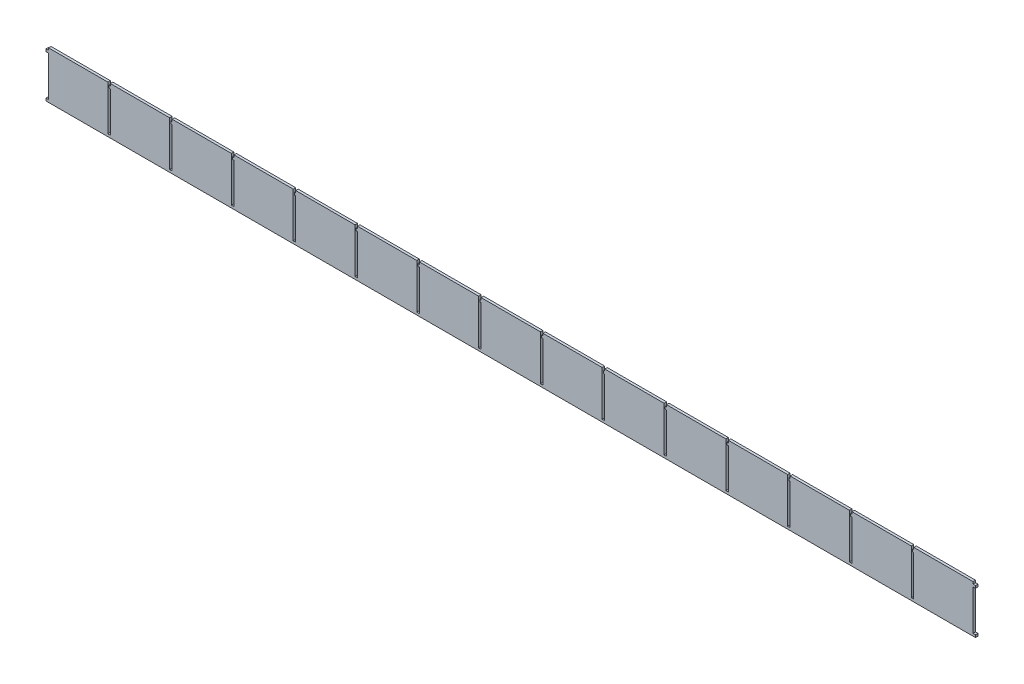
from build123d import *

# Parameters (mm, degrees)
BOSS_EXTRUDE1_DEPTH = 4


with BuildPart() as part:
    # Sketch2 → Boss-Extrude1 (new body)
    with BuildSketch(Plane.XY):
        Polygon((-666.946628487, 43.568155794), (-762.946628487, 43.568155794), (-762.946628487, 40.044337109), (-766.946628487, 40.044337109), (-766.946628487, 36.144337109), (-762.946628487, 36.144337109), (-762.946628487, -28.948182921), (-766.946628487, -28.948182921), (-766.946628487, -32.948182921), (737.053371513, -32.948182921), (737.053371513, -28.948182921), (733.053371513, -28.948182921), (733.053371513, 36.144337109), (734.953371513, 36.144337109), (737.053371513, 36.144337109), (737.053371513, 40.044337109), (733.053371513, 40.044337109), (733.053371513, 43.568155794), (637.053371513, 43.568155794), (637.053371513, 40.044337109), (634.953371513, 40.044337109), (634.953371513, 36.144337109), (637.053371513, 36.144337109), (637.053371513, -28.948182921), (633.053371513, -28.948182921), (633.053371513, 43.568155794), (537.053371513, 43.568155794), (537.053371513, 40.044337109), (534.953371513, 40.044337109), (534.953371513, 36.144337109), (537.053371513, 36.144337109), (537.053371513, -28.948182921), (533.053371513, -28.948182921), (533.053371513, 43.568155794), (437.053371513, 43.568155794), (437.053371513, 40.044337109), (434.953371513, 40.044337109), (434.953371513, 36.144337109), (437.053371513, 36.144337109), (437.053371513, -28.948182921), (433.053371513, -28.948182921), (433.053371513, 43.568155794), (337.053371513, 43.568155794), (337.053371513, 40.044337109), (334.953371513, 40.044337109), (334.953371513, 36.144337109), (337.053371513, 36.144337109), (337.053371513, -28.948182921), (333.053371513, -28.948182921), (333.053371513, 43.568155794), (237.053371513, 43.568155794), (237.053371513, 40.044337109), (234.953371513, 40.044337109), (234.953371513, 36.144337109), (237.053371513, 36.144337109), (237.053371513, -28.948182921), (233.053371513, -28.948182921), (233.053371513, 43.568155794), (137.053371513, 43.568155794), (137.053371513, 40.044337109), (134.953371513, 40.044337109), (134.953371513, 36.144337109), (137.053371513, 36.144337109), (137.053371513, -28.948182921), (133.053371513, -28.948182921), (133.053371513, 43.568155794), (37.053371513, 43.568155794), (37.053371513, 40.044337109), (34.953371513, 40.044337109), (34.953371513, 36.144337109), (37.053371513, 36.144337109), (37.053371513, -28.948182921), (33.053371513, -28.948182921), (33.053371513, 43.568155794), (-62.946628487, 43.568155794), (-62.946628487, 40.044337109), (-65.046628487, 40.044337109), (-65.046628487, 36.144337109), (-62.946628487, 36.144337109), (-62.946628487, -28.948182921), (-66.946628487, -28.948182921), (-66.946628487, 43.568155794), (-162.946628487, 43.568155794), (-162.946628487, 40.044337109), (-165.046628487, 40.044337109), (-165.046628487, 36.144337109), (-162.946628487, 36.144337109), (-162.946628487, -28.948182921), (-166.946628487, -28.948182921), (-166.946628487, 43.568155794), (-262.946628487, 43.568155794), (-262.946628487, 40.044337109), (-265.046628487, 40.044337109), (-265.046628487, 36.144337109), (-262.946628487, 36.144337109), (-262.946628487, -28.948182921), (-266.946628487, -28.948182921), (-266.946628487, 43.568155794), (-362.946628487, 43.568155794), (-362.946628487, 40.044337109), (-365.046628487, 40.044337109), (-365.046628487, 36.144337109), (-362.946628487, 36.144337109), (-362.946628487, -28.948182921), (-366.946628487, -28.948182921), (-366.946628487, 43.568155794), (-462.946628487, 43.568155794), (-462.946628487, 40.044337109), (-465.046628487, 40.044337109), (-465.046628487, 36.144337109), (-462.946628487, 36.144337109), (-462.946628487, -28.948182921), (-466.946628487, -28.948182921), (-466.946628487, 43.568155794), (-562.946628487, 43.568155794), (-562.946628487, 40.044337109), (-565.046628487, 40.044337109), (-565.046628487, 36.144337109), (-562.946628487, 36.144337109), (-562.946628487, -28.948182921), (-566.946628487, -28.948182921), (-566.946628487, 43.568155794), (-662.946628487, 43.568155794), (-662.946628487, 40.044337109), (-665.046628487, 40.044337109), (-665.046628487, 36.144337109), (-662.946628487, 36.144337109), (-662.946628487, -28.948182921), (-666.946628487, -28.948182921), align=None)
    extrude(amount=BOSS_EXTRUDE1_DEPTH)


solid = part.part
